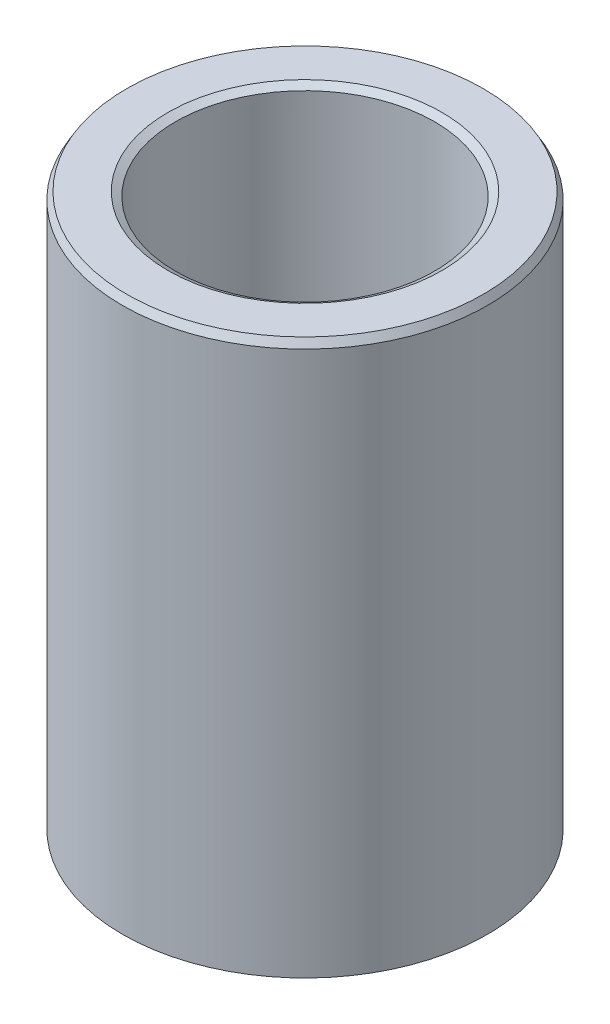
from build123d import *
from OCP.BRepFilletAPI import BRepFilletAPI_MakeChamfer

# Parameters (mm, degrees)
SKETCH1_R           = 20
BOSS_EXTRUDE1_DEPTH = 60.960016301
SKETCH2_R           = 14.192337643
CUT_EXTRUDE1_DEPTH  = 68.202109992
CHAMFER1_SIZE       = 0.819024153
CHAMFER1_SIZE2      = 0.472863815


with BuildPart() as part:
    # Sketch1 → Boss-Extrude1 (new body)
    with BuildSketch(Plane(origin=(0, 0, 0), x_dir=(1, 0, 0), z_dir=(0, 1, 0))):
        Circle(SKETCH1_R)
    extrude(amount=BOSS_EXTRUDE1_DEPTH)

    # Sketch2 → Cut-Extrude1 (cut, through all)
    with BuildSketch(Plane(origin=(0, 0, 0), x_dir=(1, 0, 0), z_dir=(0, 1, 0))):
        Circle(SKETCH2_R)
    extrude(amount=CUT_EXTRUDE1_DEPTH, mode=Mode.SUBTRACT)

    # Chamfer1: one chamfer whose edges measure the first distance from different faces: ONE call of the kernel's chamfer builder (chamfer() names one face for all edges)
    chamfer1_edges_1 = [part.edges().sort_by_distance(p)[0] for p in [
        (-14.192337643, 60.960016301, 0),
    ]]
    chamfer1_side_1 = [part.faces().sort_by_distance(p)[0] for p in [
        (-19.434314575, 60.960016301, 0),
    ]]
    chamfer1_edges_2 = [part.edges().sort_by_distance(p)[0] for p in [
        (-14.192337643, 0, 0),
    ]]
    chamfer1_side_2 = [part.faces().sort_by_distance(p)[0] for p in [
        (-14.192337643, 30.48000815, 0),
    ]]
    chamfer1_edges_3 = [part.edges().sort_by_distance(p)[0] for p in [
        (-20, 0, 0),
    ]]
    chamfer1_side_3 = [part.faces().sort_by_distance(p)[0] for p in [
        (-19.434314575, 0, 0),
    ]]
    chamfer1_edges_4 = [part.edges().sort_by_distance(p)[0] for p in [
        (-20, 60.960016301, 0),
    ]]
    chamfer1_side_4 = [part.faces().sort_by_distance(p)[0] for p in [
        (-20, 30.48000815, 0),
    ]]
    chamfer1 = BRepFilletAPI_MakeChamfer(part.part.solid().wrapped)
    for e in chamfer1_edges_1:
        chamfer1.Add(CHAMFER1_SIZE, CHAMFER1_SIZE2, e.wrapped, chamfer1_side_1[0].wrapped)  # the first distance lies on this face
    for e in chamfer1_edges_2:
        chamfer1.Add(CHAMFER1_SIZE, CHAMFER1_SIZE2, e.wrapped, chamfer1_side_2[0].wrapped)  # the first distance lies on this face
    for e in chamfer1_edges_3:
        chamfer1.Add(CHAMFER1_SIZE, CHAMFER1_SIZE2, e.wrapped, chamfer1_side_3[0].wrapped)  # the first distance lies on this face
    for e in chamfer1_edges_4:
        chamfer1.Add(CHAMFER1_SIZE, CHAMFER1_SIZE2, e.wrapped, chamfer1_side_4[0].wrapped)  # the first distance lies on this face
    add(Compound.cast(chamfer1.Shape()), mode=Mode.REPLACE)


solid = part.part
